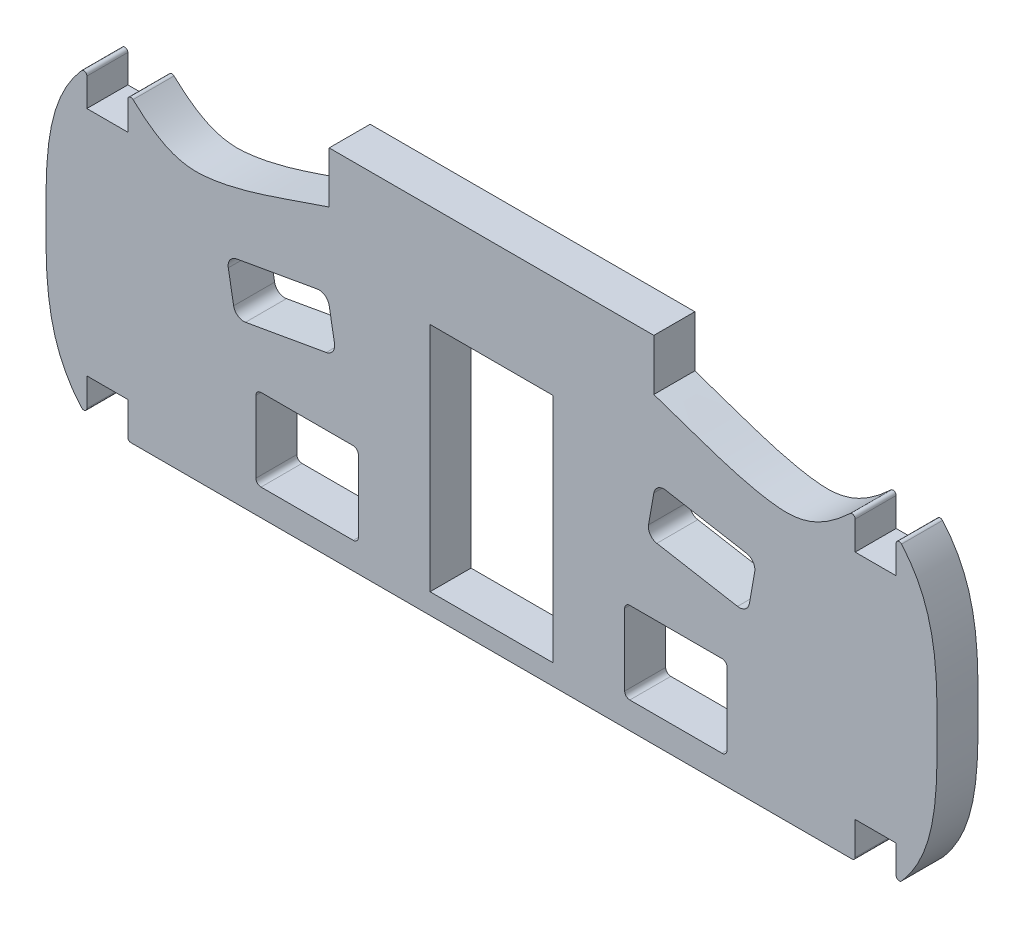
from build123d import *

# Parameters (mm, degrees)
ESTRUSIONE_ESTRUSIONE1_OUTLINE_W   = 10
ESTRUSIONE_ESTRUSIONE1_OUTLINE_H   = 8
ESTRUSIONE_ESTRUSIONE1_OUTLINE_W_2 = 12
ESTRUSIONE_ESTRUSIONE1_OUTLINE_H_2 = 22.6
ESTRUSIONE_ESTRUSIONE1_DEPTH       = 4
RACCORDO1_R                        = 1
RACCORDO3_R                        = 0.5
RACCORDO4_R                        = 0.3
SCHIZZO3_W                         = 31.69719665
SCHIZZO3_H                         = 4
ESTRUSIONE_ESTRUSIONE2_DEPTH       = 5


# Read off the part's stored shape, not the designer's step: Estrusione-Estrusione1
with BuildPart() as part:
    # Estrusione-Estrusione1 outline → Estrusione-Estrusione1 (new body)
    with BuildSketch(Plane.XY):
        with BuildLine():
            Line((-35.5, 26.1), (-39.5, 26.1))
            Line((-39.5, 26.1), (-39.5, 29.6))
            add(Edge.make_bspline(
                [(-39.5, 29.6), (-43.506938427, 25.593061573), (-43.493061573, 14.8), (-43.506938427, 4.006938427), (-39.5, 0)],
                knots=[0, 0, 0, 0, 0.5, 1, 1, 1, 1], degree=3))
            Line((-39.5, 0), (-39.5, 3.5))
            Line((-39.5, 3.5), (-35.5, 3.5))
            Line((-35.5, 3.5), (-35.5, 0))
            Line((-35.5, 0), (35.5, 0))
            Line((35.5, 0), (35.5, 3.5))
            Line((35.5, 3.5), (39.5, 3.5))
            Line((39.5, 3.5), (39.5, 0))
            add(Edge.make_bspline(
                [(39.5, 29.6), (43.506938427, 25.593061573), (43.493061573, 14.8), (43.506938427, 4.006938427), (39.5, 0)],
                knots=[0, 0, 0, 0, 0.5, 1, 1, 1, 1], degree=3))
            Line((39.5, 29.6), (39.5, 26.1))
            Line((39.5, 26.1), (35.5, 26.1))
            Line((35.5, 26.1), (35.5, 29.6))
            add(Edge.make_bspline(
                [(35.5, 29.6), (31.962623794, 26.062612753), (26.4060962, 25.659880805), (20.342579531, 28.112334068), (15.848598331, 29.600000017)],
                knots=[0, 0, 0, 0, 0.358970883, 0.890087037, 0.890087037, 0.890087037, 0.890087037], degree=3))
            Line((15.848598331, 29.600000017), (-15.848598331, 29.600000017))
            add(Edge.make_bspline(
                [(-35.5, 29.6), (-31.962623794, 26.062612753), (-26.4060962, 25.659880805), (-20.342579531, 28.112334068), (-15.848598331, 29.600000017)],
                knots=[0, 0, 0, 0, 0.358970883, 0.890087037, 0.890087037, 0.890087037, 0.890087037], degree=3))
            Line((-35.5, 29.6), (-35.5, 26.1))
        make_face()
        with Locations((-18, 6.6)):
            Rectangle(ESTRUSIONE_ESTRUSIONE1_OUTLINE_W, ESTRUSIONE_ESTRUSIONE1_OUTLINE_H, mode=Mode.SUBTRACT)
        with Locations((18, 6.6)):
            Rectangle(ESTRUSIONE_ESTRUSIONE1_OUTLINE_W, ESTRUSIONE_ESTRUSIONE1_OUTLINE_H, mode=Mode.SUBTRACT)
        with Locations((0, 13.3)):
            Rectangle(ESTRUSIONE_ESTRUSIONE1_OUTLINE_W_2, ESTRUSIONE_ESTRUSIONE1_OUTLINE_H_2, mode=Mode.SUBTRACT)
        Polygon((-25.868240888, 20.524038765), (-16.020163358, 22.260520542), (-15.15192247, 17.336481777), (-25, 15.6), align=None, mode=Mode.SUBTRACT)
        Polygon((16.020163358, 22.260520542), (25.868240888, 20.524038765), (25, 15.6), (15.15192247, 17.336481777), align=None, mode=Mode.SUBTRACT)
    extrude(amount=ESTRUSIONE_ESTRUSIONE1_DEPTH)

    # Raccordo1
    raccordo1_edges = [part.edges().sort_by_distance(p)[0] for p in [
        (16.020163358, 22.260520542, 2),
        (15.15192247, 17.336481777, 2),
        (25, 15.6, 2),
        (25.868240888, 20.524038765, 2),
        (-25.868240888, 20.524038765, 2),
        (-25, 15.6, 2),
        (-15.15192247, 17.336481777, 2),
        (-16.020163358, 22.260520542, 2),
    ]]
    fillet(raccordo1_edges, radius=RACCORDO1_R)

    # Raccordo3
    raccordo3_edges = [part.edges().sort_by_distance(p)[0] for p in [
        (13, 10.6, 2),
        (13, 2.6, 2),
        (23, 2.6, 2),
        (23, 10.6, 2),
        (-23, 10.6, 2),
        (-23, 2.6, 2),
        (-13, 2.6, 2),
        (-13, 10.6, 2),
    ]]
    fillet(raccordo3_edges, radius=RACCORDO3_R)

    # Raccordo4
    raccordo4_edges = [part.edges().sort_by_distance(p)[0] for p in [
        (-39.5, 0, 2),
        (39.5, 0, 2),
        (39.5, 29.6, 2),
        (35.5, 29.6, 2),
        (-39.5, 29.6, 2),
        (-35.5, 29.6, 2),
        (35.5, 0, 2),
        (-35.5, 0, 2),
    ]]
    fillet(raccordo4_edges, radius=RACCORDO4_R)

    # Schizzo3 → Estrusione-Estrusione2 (add)
    with BuildSketch(Plane(origin=(0, 29.6, 0), x_dir=(1, 0, 0), z_dir=(0, 1, 0))):
        with Locations((0, -2)):
            Rectangle(SCHIZZO3_W, SCHIZZO3_H)
    extrude(amount=ESTRUSIONE_ESTRUSIONE2_DEPTH)


solid = part.part
